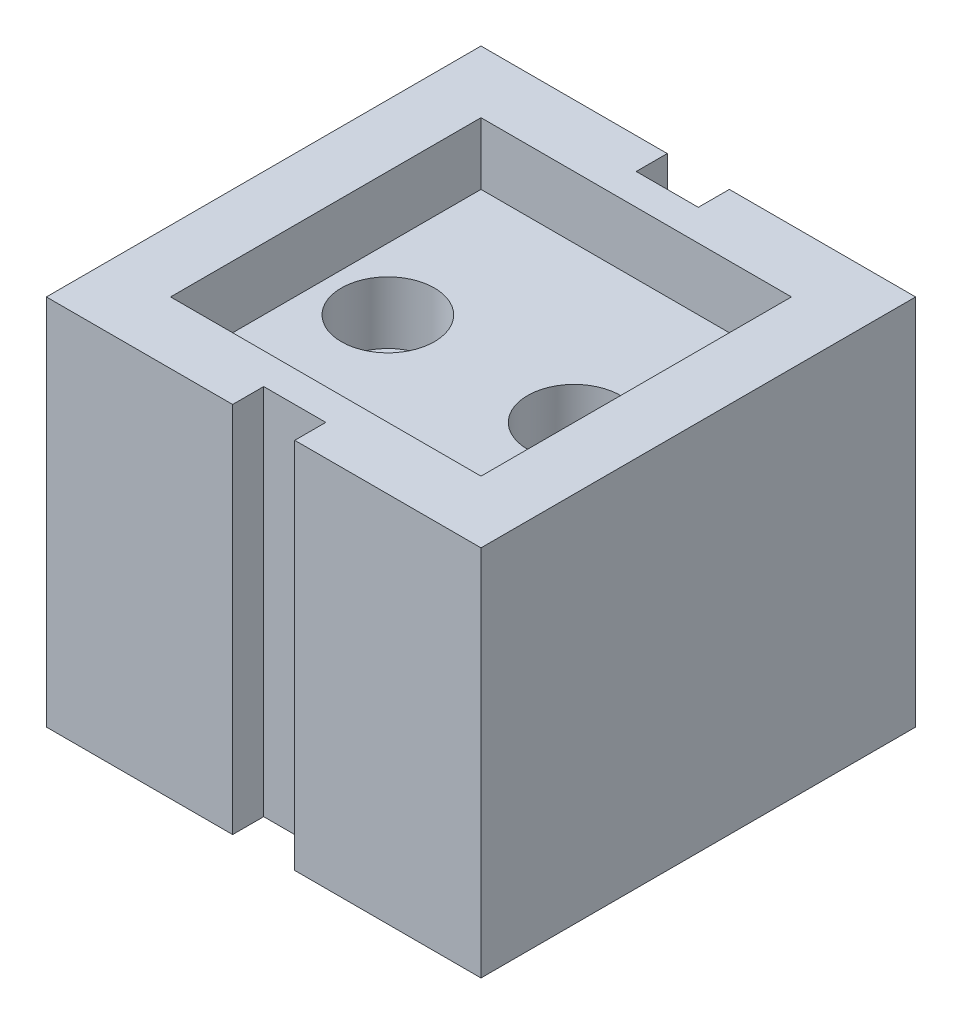
from build123d import *

# Parameters (mm, degrees)
SKETCH1_W           = 7
SKETCH1_H           = 7
BOSS_EXTRUDE1_DEPTH = 6
SKETCH3_W           = 5
SKETCH3_H           = 5
CUT_EXTRUDE1_DEPTH  = 1
SKETCH2_R           = 0.75
CUT_EXTRUDE2_DEPTH  = 2
SKETCH4_W           = 1
SKETCH4_H           = 1
CUT_EXTRUDE3_DEPTH  = 8.778174593


with BuildPart() as part:
    # Sketch1 → Boss-Extrude1 (new body)
    with BuildSketch(Plane(origin=(0, 0, 0), x_dir=(1, 0, 0), z_dir=(0, 1, 0))):
        Rectangle(SKETCH1_W, SKETCH1_H)
    extrude(amount=BOSS_EXTRUDE1_DEPTH)

    # Sketch3 → Cut-Extrude1 (cut)
    with BuildSketch(Plane(origin=(0, 6, 0), x_dir=(1, 0, 0), z_dir=(0, 1, 0))):
        Rectangle(SKETCH3_W, SKETCH3_H)
    extrude(amount=-CUT_EXTRUDE1_DEPTH, mode=Mode.SUBTRACT)

    # Sketch2 → Cut-Extrude2 (cut)
    with BuildSketch(Plane(origin=(0, 6, 0), x_dir=(1, 0, 0), z_dir=(0, 1, 0))):
        with Locations((-1.5, 0)):
            Circle(SKETCH2_R)
        with Locations((1.5, 0)):
            Circle(SKETCH2_R)
    extrude(amount=-CUT_EXTRUDE2_DEPTH, mode=Mode.SUBTRACT)

    # Sketch4 → Cut-Extrude3 (cut, through all)
    with BuildSketch(Plane(origin=(0, 6, 0), x_dir=(1, 0, 0), z_dir=(0, 1, 0))):
        with Locations((0, -3.5)):
            Rectangle(SKETCH4_W, SKETCH4_H)
        with Locations((0, 3.5)):
            Rectangle(SKETCH4_W, SKETCH4_H)
    extrude(amount=-CUT_EXTRUDE3_DEPTH, mode=Mode.SUBTRACT)


solid = part.part
